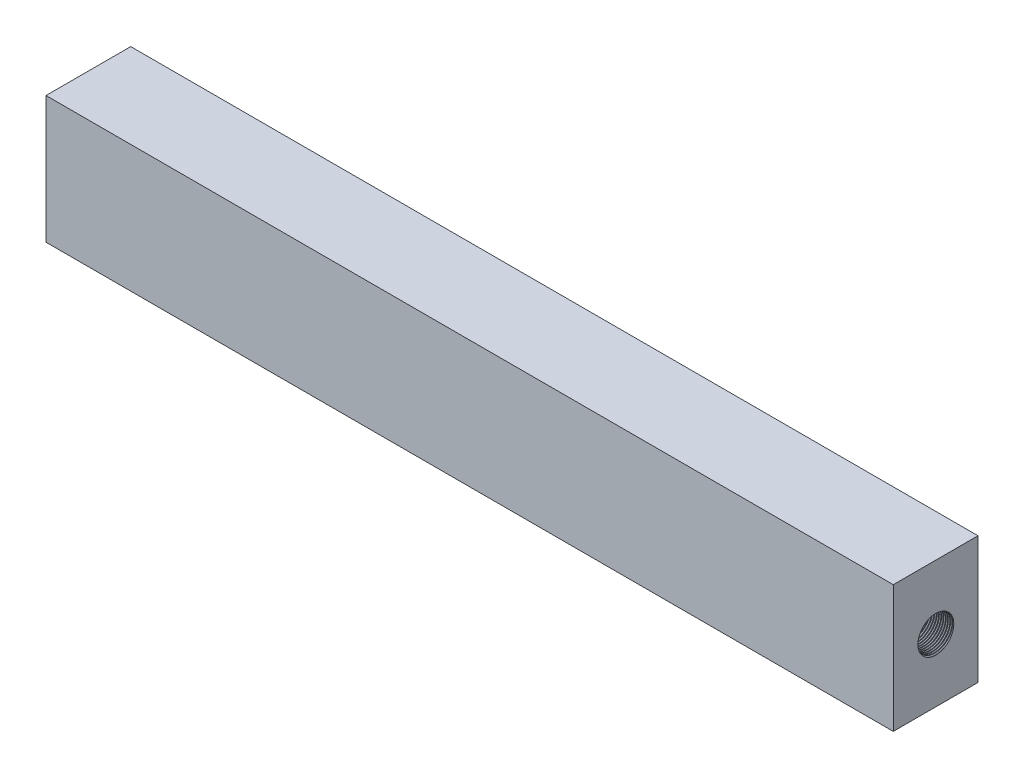
from build123d import *

# Parameters (mm, degrees)
SKETCH_1_W          = 400
SKETCH_1_H          = 60
EXTRUDE_1_DEPTH     = 40
SKETCH_12_R         = 8.25
SKETCH_12_R_2       = 6
CUT_EXTRUDE_3_DEPTH = 15
CUT_EXTRUDE_START   = -385
SKETCH_12_4_R       = 8.25
SKETCH_12_4_R_2     = 6
CUT_EXTRUDE_4_DEPTH = 15
CUT_EXTRUDE_START_2 = -15
SKETCH_12_5_R       = 6
CUT_EXTRUDE_5_DEPTH = 15
CUT_EXTRUDE_START_3 = -370
SKETCH_12_6_R       = 6
CUT_EXTRUDE_6_DEPTH = 15
THREAD_5_PITCH      = 1.058333333
THREAD_6_PITCH      = 1.058333333
CUT_EXTRUDE_START_4 = -4
CUT_EXTRUDE_7_DEPTH = 32


with BuildPart() as part:
    # Sketch 1 → 凸台-拉伸1 (new body)
    with BuildSketch(Plane.XY):
        with Locations((18.926224658, -58.527918782)):
            Rectangle(SKETCH_1_W, SKETCH_1_H)
    extrude(amount=EXTRUDE_1_DEPTH)

    # 草图12 → 切除-拉伸3 (cut)
    # profile 1 of 2: a face of its own
    with BuildSketch(Plane(origin=(218.926224658, 0, 0), x_dir=(0, 0, -1), z_dir=(1, 0, 0))):
        with Locations(Location((-20, -58.527918782, 0), (0, 0, 90))):
            Circle(SKETCH_12_R)
        with Locations((-20, -58.527918782)):
            Circle(SKETCH_12_R_2, mode=Mode.SUBTRACT)
    # profile 2 of 2: a face of its own
    with BuildSketch(Plane(origin=(218.926224658, 0, 0), x_dir=(0, 0, -1), z_dir=(1, 0, 0))):
        with Locations((-20, -58.527918782)):
            Circle(SKETCH_12_R_2)
    extrude(amount=-CUT_EXTRUDE_3_DEPTH, mode=Mode.SUBTRACT)

    # 草图12<4> → 切除-拉伸4 (cut)
    # profile 1 of 2: a face of its own
    with BuildSketch(Plane(origin=(218.926224658, 0, 0), x_dir=(0, 0, -1), z_dir=(1, 0, 0)).offset(CUT_EXTRUDE_START)):
        with Locations(Location((-20, -58.527918782, 0), (0, 0, 90))):
            Circle(SKETCH_12_4_R)
        with Locations((-20, -58.527918782)):
            Circle(SKETCH_12_4_R_2, mode=Mode.SUBTRACT)
    # profile 2 of 2: a face of its own
    with BuildSketch(Plane(origin=(218.926224658, 0, 0), x_dir=(0, 0, -1), z_dir=(1, 0, 0)).offset(CUT_EXTRUDE_START)):
        with Locations((-20, -58.527918782)):
            Circle(SKETCH_12_4_R_2)
    extrude(amount=-CUT_EXTRUDE_4_DEPTH, mode=Mode.SUBTRACT)

    # 草图12<5> → 切除-拉伸5 (cut)
    with BuildSketch(Plane(origin=(218.926224658, 0, 0), x_dir=(0, 0, -1), z_dir=(1, 0, 0)).offset(CUT_EXTRUDE_START_2)):
        with Locations(Location((-20, -58.527918782, 0), (0, 0, 90))):
            Circle(SKETCH_12_5_R)
    extrude(amount=-CUT_EXTRUDE_5_DEPTH, mode=Mode.SUBTRACT)

    # 草图12<6> → 切除-拉伸6 (cut)
    with BuildSketch(Plane(origin=(218.926224658, 0, 0), x_dir=(0, 0, -1), z_dir=(1, 0, 0)).offset(CUT_EXTRUDE_START_3)):
        with Locations(Location((-20, -58.527918782, 0), (0, 0, 90))):
            Circle(SKETCH_12_6_R)
    extrude(amount=-CUT_EXTRUDE_6_DEPTH, mode=Mode.SUBTRACT)

    # 螺纹线5: arcs per turn and ends read off the stored shape
    # 螺纹线5: the profile of 螺纹线轮廓5 profile screwed along a right-hand helix through 14.173228 turns, 8 arcs to a turn; built about Z, then put on its axis
    thread_5_z = Axis((0, 0, 0), (0, 0, 1))
    thread_5_corners = [(8.2497, 0, -0.000173205), (8.822839718, 0, 0.330729165), (8.822839718, 0, 0.463020832), (8.2497, 0, 0.793923202)]
    with BuildLine(mode=Mode.PRIVATE) as thread_5_profile:
        Line(thread_5_corners[0], thread_5_corners[1])
        Line(thread_5_corners[1], thread_5_corners[2])
        Line(thread_5_corners[2], thread_5_corners[3])
        Line(thread_5_corners[3], thread_5_corners[0])
    thread_5_cap = Face(thread_5_profile.wire())
    thread_5_turn_angles = [0, 22.5, 45, 67.5, 90, 112.5, 135, 157.5, 180, 202.5, 225, 247.5, 270, 292.5, 315, 337.5, 360]
    thread_5_turn_weights = [1, 0.9238795325112867, 1, 0.9238795325112867, 1, 0.9238795325112867, 1, 0.9238795325112867, 1, 0.9238795325112867, 1, 0.9238795325112867, 1, 0.9238795325112867, 1, 0.9238795325112867, 1]
    thread_5_turn_rails = [Edge.make_bspline([Vector(p[0], p[1], 0).rotate(thread_5_z, thread_5_turn_angles[k]) / thread_5_turn_weights[k] + Vector(0, 0, p[2] + THREAD_5_PITCH * thread_5_turn_angles[k] / 360) for k in range(17)], [0, 0, 0, 1, 1, 2, 2, 3, 3, 4, 4, 5, 5, 6, 6, 7, 7, 8, 8, 8], 2, thread_5_turn_weights) for p in thread_5_corners]
    thread_5_turn_sides = [Face.make_surface_from_curves(thread_5_turn_rails[p[0]], thread_5_turn_rails[p[1]]) for p in [(0, 1), (1, 2), (2, 3), (3, 0)]]
    thread_5_last_angles = [5040, 5062.5, 5085, 5093.681102362, 5102.362204724]
    thread_5_last_weights = [1, 0.9238795325112867, 1, 0.9885437227923798, 1]
    thread_5_last_rails = [Edge.make_bspline([Vector(p[0], p[1], 0).rotate(thread_5_z, thread_5_last_angles[k]) / thread_5_last_weights[k] + Vector(0, 0, p[2] + THREAD_5_PITCH * thread_5_last_angles[k] / 360) for k in range(5)], [0, 0, 0, 1, 1, 2, 2, 2], 2, thread_5_last_weights) for p in thread_5_corners]
    thread_5_last_sides = [Face.make_surface_from_curves(thread_5_last_rails[p[0]], thread_5_last_rails[p[1]]) for p in [(0, 1), (1, 2), (2, 3), (3, 0)]]
    thread_5 = Plane(origin=(-166.073775342, -58.527918782, 20), x_dir=(0, 0, 1), z_dir=(-1, 0, 0)) * Solid(Shell([*[p.moved(Location((0, 0, THREAD_5_PITCH * i))) for i in range(14) for p in thread_5_turn_sides], *thread_5_last_sides, thread_5_cap, thread_5_cap.rotate(thread_5_z, 5102.362204724).moved(Location((0, 0, THREAD_5_PITCH * 5102.362204724 / 360)))]))
    add(thread_5, mode=Mode.SUBTRACT)

    # 螺纹线6: arcs per turn and ends read off the stored shape
    # 螺纹线6: the profile of 螺纹线轮廓6 profile screwed along a right-hand helix through 14.173228 turns, 8 arcs to a turn; built about Z, then put on its axis
    thread_6_z = Axis((0, 0, 0), (0, 0, 1))
    thread_6_corners = [(8.2497, 0, -0.000173205), (8.822839718, 0, 0.330729165), (8.822839718, 0, 0.463020832), (8.2497, 0, 0.793923202)]
    with BuildLine(mode=Mode.PRIVATE) as thread_6_profile:
        Line(thread_6_corners[0], thread_6_corners[1])
        Line(thread_6_corners[1], thread_6_corners[2])
        Line(thread_6_corners[2], thread_6_corners[3])
        Line(thread_6_corners[3], thread_6_corners[0])
    thread_6_cap = Face(thread_6_profile.wire())
    thread_6_turn_angles = [0, 22.5, 45, 67.5, 90, 112.5, 135, 157.5, 180, 202.5, 225, 247.5, 270, 292.5, 315, 337.5, 360]
    thread_6_turn_weights = [1, 0.9238795325112867, 1, 0.9238795325112867, 1, 0.9238795325112867, 1, 0.9238795325112867, 1, 0.9238795325112867, 1, 0.9238795325112867, 1, 0.9238795325112867, 1, 0.9238795325112867, 1]
    thread_6_turn_rails = [Edge.make_bspline([Vector(p[0], p[1], 0).rotate(thread_6_z, thread_6_turn_angles[k]) / thread_6_turn_weights[k] + Vector(0, 0, p[2] + THREAD_6_PITCH * thread_6_turn_angles[k] / 360) for k in range(17)], [0, 0, 0, 1, 1, 2, 2, 3, 3, 4, 4, 5, 5, 6, 6, 7, 7, 8, 8, 8], 2, thread_6_turn_weights) for p in thread_6_corners]
    thread_6_turn_sides = [Face.make_surface_from_curves(thread_6_turn_rails[p[0]], thread_6_turn_rails[p[1]]) for p in [(0, 1), (1, 2), (2, 3), (3, 0)]]
    thread_6_last_angles = [5040, 5062.5, 5085, 5093.681102362, 5102.362204724]
    thread_6_last_weights = [1, 0.9238795325112867, 1, 0.9885437227923929, 1]
    thread_6_last_rails = [Edge.make_bspline([Vector(p[0], p[1], 0).rotate(thread_6_z, thread_6_last_angles[k]) / thread_6_last_weights[k] + Vector(0, 0, p[2] + THREAD_6_PITCH * thread_6_last_angles[k] / 360) for k in range(5)], [0, 0, 0, 1, 1, 2, 2, 2], 2, thread_6_last_weights) for p in thread_6_corners]
    thread_6_last_sides = [Face.make_surface_from_curves(thread_6_last_rails[p[0]], thread_6_last_rails[p[1]]) for p in [(0, 1), (1, 2), (2, 3), (3, 0)]]
    thread_6 = Plane(origin=(203.926224658, -58.527918782, 20), x_dir=(0, 0, -1), z_dir=(1, 0, 0)) * Solid(Shell([*[p.moved(Location((0, 0, THREAD_6_PITCH * i))) for i in range(14) for p in thread_6_turn_sides], *thread_6_last_sides, thread_6_cap, thread_6_cap.rotate(thread_6_z, 5102.362204724).moved(Location((0, 0, THREAD_6_PITCH * 5102.362204724 / 360)))]))
    add(thread_6, mode=Mode.SUBTRACT)

    # 草图17 → 切除-拉伸7 (cut)
    with BuildSketch(Plane.XY.offset(40).offset(CUT_EXTRUDE_START_4)):
        with BuildLine():
            Line((-151.073775342, -41.527918782), (-151.073775342, -75.527918782))
            ThreePointArc((-151.073775342, -75.527918782), (-143.073775342, -83.527918782), (-135.073775342, -75.527918782))
            Line((-135.073775342, -75.527918782), (-135.073775342, -41.527918782))
            Line((-135.073775342, -41.527918782), (-133.073775342, -41.527918782))
            Line((-133.073775342, -41.527918782), (-131.073775342, -41.527918782))
            Line((-131.073775342, -41.527918782), (-131.073775342, -75.527918782))
            ThreePointArc((-131.073775342, -75.527918782), (-128.730629591, -81.184773031), (-123.073775342, -83.527918782))
            Line((-123.073775342, -83.527918782), (-103.073775342, -83.527918782))
            ThreePointArc((-103.073775342, -83.527918782), (-97.416921092, -81.184773031), (-95.073775342, -75.527918782))
            Line((-95.073775342, -75.527918782), (-95.073775342, -41.527918782))
            Line((-95.073775342, -41.527918782), (-93.073775342, -41.527918782))
            Line((-93.073775342, -41.527918782), (-91.073775342, -41.527918782))
            Line((-91.073775342, -41.527918782), (-91.073775342, -75.527918782))
            ThreePointArc((-91.073775342, -75.527918782), (-88.730629591, -81.184773031), (-83.073775342, -83.527918782))
            Line((-83.073775342, -83.527918782), (-63.073775342, -83.527918782))
            ThreePointArc((-63.073775342, -83.527918782), (-57.416921092, -81.184773031), (-55.073775342, -75.527918782))
            Line((-55.073775342, -75.527918782), (-55.073775342, -41.527918782))
            Line((-55.073775342, -41.527918782), (-53.073775342, -41.527918782))
            Line((-53.073775342, -41.527918782), (-51.073775342, -41.527918782))
            Line((-51.073775342, -41.527918782), (-51.073775342, -75.527918782))
            ThreePointArc((-51.073775342, -75.527918782), (-48.730629591, -81.184773031), (-43.073775342, -83.527918782))
            Line((-43.073775342, -83.527918782), (-23.073775342, -83.527918782))
            ThreePointArc((-23.073775342, -83.527918782), (-17.416921092, -81.184773031), (-15.073775342, -75.527918782))
            Line((-15.073775342, -75.527918782), (-15.073775342, -41.527918782))
            Line((-15.073775342, -41.527918782), (-13.073775342, -41.527918782))
            Line((-13.073775342, -41.527918782), (-11.073775342, -41.527918782))
            Line((-11.073775342, -41.527918782), (-11.073775342, -75.527918782))
            ThreePointArc((-11.073775342, -75.527918782), (-8.730629591, -81.184773031), (-3.073775342, -83.527918782))
            Line((-3.073775342, -83.527918782), (16.926224658, -83.527918782))
            ThreePointArc((16.926224658, -83.527918782), (22.583078908, -81.184773031), (24.926224658, -75.527918782))
            Line((24.926224658, -75.527918782), (24.926224658, -41.527918782))
            Line((24.926224658, -41.527918782), (26.926224658, -41.527918782))
            Line((26.926224658, -41.527918782), (28.926224658, -41.527918782))
            Line((28.926224658, -41.527918782), (28.926224658, -75.527918782))
            ThreePointArc((28.926224658, -75.527918782), (31.269370409, -81.184773031), (36.926224658, -83.527918782))
            Line((36.926224658, -83.527918782), (56.926224658, -83.527918782))
            ThreePointArc((56.926224658, -83.527918782), (62.583078908, -81.184773031), (64.926224658, -75.527918782))
            Line((64.926224658, -75.527918782), (64.926224658, -41.527918782))
            Line((64.926224658, -41.527918782), (66.926224658, -41.527918782))
            Line((66.926224658, -41.527918782), (68.926224658, -41.527918782))
            Line((68.926224658, -41.527918782), (68.926224658, -75.527918782))
            ThreePointArc((68.926224658, -75.527918782), (71.269370409, -81.184773031), (76.926224658, -83.527918782))
            Line((76.926224658, -83.527918782), (96.926224658, -83.527918782))
            ThreePointArc((96.926224658, -83.527918782), (102.583078908, -81.184773031), (104.926224658, -75.527918782))
            Line((104.926224658, -75.527918782), (104.926224658, -41.527918782))
            Line((104.926224658, -41.527918782), (106.926224658, -41.527918782))
            Line((106.926224658, -41.527918782), (108.926224658, -41.527918782))
            Line((108.926224658, -41.527918782), (108.926224658, -75.527918782))
            ThreePointArc((108.926224658, -75.527918782), (111.269370409, -81.184773031), (116.926224658, -83.527918782))
            Line((116.926224658, -83.527918782), (136.926224658, -83.527918782))
            ThreePointArc((136.926224658, -83.527918782), (142.583078908, -81.184773031), (144.926224658, -75.527918782))
            Line((144.926224658, -75.527918782), (144.926224658, -41.527918782))
            Line((144.926224658, -41.527918782), (146.926224658, -41.527918782))
            Line((146.926224658, -41.527918782), (148.926224658, -41.527918782))
            Line((148.926224658, -41.527918782), (148.926224658, -75.527918782))
            ThreePointArc((148.926224658, -75.527918782), (151.269370409, -81.184773031), (156.926224658, -83.527918782))
            Line((156.926224658, -83.527918782), (180.926224658, -83.527918782))
            ThreePointArc((180.926224658, -83.527918782), (186.583078908, -81.184773031), (188.926224658, -75.527918782))
            Line((188.926224658, -75.527918782), (188.926224658, -41.527918782))
            ThreePointArc((188.926224658, -41.527918782), (186.583078908, -35.871064532), (180.926224658, -33.527918782))
            Line((180.926224658, -33.527918782), (176.926224658, -33.527918782))
            ThreePointArc((176.926224658, -33.527918782), (171.269370409, -35.871064532), (168.926224658, -41.527918782))
            Line((168.926224658, -41.527918782), (168.926224658, -75.527918782))
            Line((168.926224658, -75.527918782), (166.926224658, -75.527918782))
            Line((166.926224658, -75.527918782), (164.926224658, -75.527918782))
            Line((164.926224658, -75.527918782), (164.926224658, -41.527918782))
            ThreePointArc((164.926224658, -41.527918782), (162.583078908, -35.871064532), (156.926224658, -33.527918782))
            Line((156.926224658, -33.527918782), (146.926224658, -33.527918782))
            Line((146.926224658, -33.527918782), (136.926224658, -33.527918782))
            ThreePointArc((136.926224658, -33.527918782), (131.269370409, -35.871064532), (128.926224658, -41.527918782))
            Line((128.926224658, -41.527918782), (128.926224658, -75.527918782))
            Line((128.926224658, -75.527918782), (126.926224658, -75.527918782))
            Line((126.926224658, -75.527918782), (124.926224658, -75.527918782))
            Line((124.926224658, -75.527918782), (124.926224658, -41.527918782))
            ThreePointArc((124.926224658, -41.527918782), (122.583078908, -35.871064532), (116.926224658, -33.527918782))
            Line((116.926224658, -33.527918782), (106.926224658, -33.527918782))
            Line((106.926224658, -33.527918782), (96.926224658, -33.527918782))
            ThreePointArc((96.926224658, -33.527918782), (91.269370409, -35.871064532), (88.926224658, -41.527918782))
            Line((88.926224658, -41.527918782), (88.926224658, -75.527918782))
            Line((88.926224658, -75.527918782), (86.926224658, -75.527918782))
            Line((86.926224658, -75.527918782), (84.926224658, -75.527918782))
            Line((84.926224658, -75.527918782), (84.926224658, -41.527918782))
            ThreePointArc((84.926224658, -41.527918782), (82.583078908, -35.871064532), (76.926224658, -33.527918782))
            Line((76.926224658, -33.527918782), (66.926224658, -33.527918782))
            Line((66.926224658, -33.527918782), (56.926224658, -33.527918782))
            ThreePointArc((56.926224658, -33.527918782), (51.269370409, -35.871064532), (48.926224658, -41.527918782))
            Line((48.926224658, -41.527918782), (48.926224658, -75.527918782))
            Line((48.926224658, -75.527918782), (46.926224658, -75.527918782))
            Line((46.926224658, -75.527918782), (44.926224658, -75.527918782))
            Line((44.926224658, -75.527918782), (44.926224658, -41.527918782))
            ThreePointArc((44.926224658, -41.527918782), (42.583078908, -35.871064532), (36.926224658, -33.527918782))
            Line((36.926224658, -33.527918782), (26.926224658, -33.527918782))
            Line((26.926224658, -33.527918782), (16.926224658, -33.527918782))
            ThreePointArc((16.926224658, -33.527918782), (11.269370409, -35.871064532), (8.926224658, -41.527918782))
            Line((8.926224658, -41.527918782), (8.926224658, -75.527918782))
            Line((8.926224658, -75.527918782), (6.926224658, -75.527918782))
            Line((6.926224658, -75.527918782), (4.926224658, -75.527918782))
            Line((4.926224658, -75.527918782), (4.926224658, -41.527918782))
            ThreePointArc((4.926224658, -41.527918782), (2.583078908, -35.871064532), (-3.073775342, -33.527918782))
            Line((-3.073775342, -33.527918782), (-13.073775342, -33.527918782))
            Line((-13.073775342, -33.527918782), (-23.073775342, -33.527918782))
            ThreePointArc((-23.073775342, -33.527918782), (-28.730629591, -35.871064532), (-31.073775342, -41.527918782))
            Line((-31.073775342, -41.527918782), (-31.073775342, -75.527918782))
            Line((-31.073775342, -75.527918782), (-33.073775342, -75.527918782))
            Line((-33.073775342, -75.527918782), (-35.073775342, -75.527918782))
            Line((-35.073775342, -75.527918782), (-35.073775342, -41.527918782))
            ThreePointArc((-35.073775342, -41.527918782), (-37.416921092, -35.871064532), (-43.073775342, -33.527918782))
            Line((-43.073775342, -33.527918782), (-53.073775342, -33.527918782))
            Line((-53.073775342, -33.527918782), (-63.073775342, -33.527918782))
            ThreePointArc((-63.073775342, -33.527918782), (-68.730629591, -35.871064532), (-71.073775342, -41.527918782))
            Line((-71.073775342, -41.527918782), (-71.073775342, -75.527918782))
            Line((-71.073775342, -75.527918782), (-73.073775342, -75.527918782))
            Line((-73.073775342, -75.527918782), (-75.073775342, -75.527918782))
            Line((-75.073775342, -75.527918782), (-75.073775342, -41.527918782))
            ThreePointArc((-75.073775342, -41.527918782), (-77.416921092, -35.871064532), (-83.073775342, -33.527918782))
            Line((-83.073775342, -33.527918782), (-93.073775342, -33.527918782))
            Line((-93.073775342, -33.527918782), (-103.073775342, -33.527918782))
            ThreePointArc((-103.073775342, -33.527918782), (-108.730629591, -35.871064532), (-111.073775342, -41.527918782))
            Line((-111.073775342, -41.527918782), (-111.073775342, -75.527918782))
            Line((-111.073775342, -75.527918782), (-113.073775342, -75.527918782))
            Line((-113.073775342, -75.527918782), (-115.073775342, -75.527918782))
            Line((-115.073775342, -75.527918782), (-115.073775342, -41.527918782))
            ThreePointArc((-115.073775342, -41.527918782), (-117.416921092, -35.871064532), (-123.073775342, -33.527918782))
            Line((-123.073775342, -33.527918782), (-133.073775342, -33.527918782))
            Line((-133.073775342, -33.527918782), (-143.073775342, -33.527918782))
            ThreePointArc((-143.073775342, -33.527918782), (-148.730629591, -35.871064532), (-151.073775342, -41.527918782))
        make_face()
    extrude(amount=-CUT_EXTRUDE_7_DEPTH, mode=Mode.SUBTRACT)


solid = part.part
